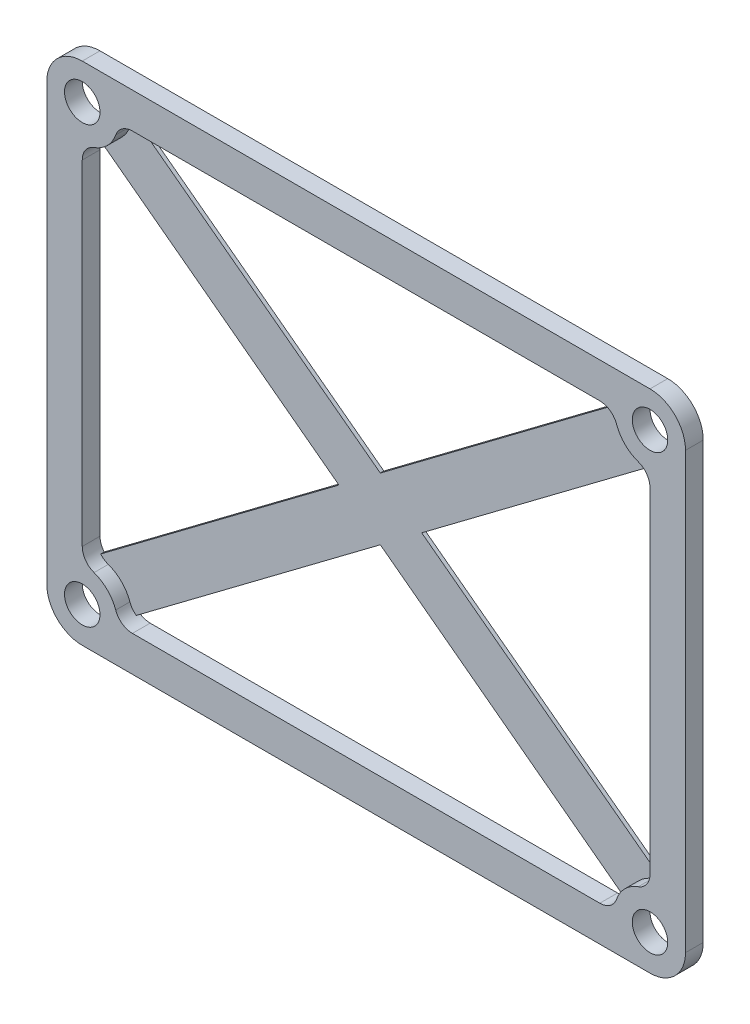
from build123d import *

# Parameters (mm, degrees)
SKETCH1_R           = 6.35
OUTLINE_DEPTH       = 6.35
FILLET2_R           = 12.7
BOSS_EXTRUDE1_DEPTH = 1.27
FILLET1_R           = 6.35


with BuildPart() as part:
    # Sketch1 → Outline (new body)
    with BuildSketch(Plane.XY):
        with BuildLine():
            Line((-101.6, 114.3), (101.6, 114.3))
            ThreePointArc((101.6, 114.3), (110.580256121, 110.580256121), (114.3, 101.6))
            Line((114.3, 101.6), (114.3, -66.802))
            Line((114.3, -66.802), (-114.3, -66.802))
            Line((-114.3, -66.802), (-114.3, 101.6))
            ThreePointArc((-114.3, 101.6), (-110.580256121, 110.580256121), (-101.6, 114.3))
        make_face()
        with Locations((-101.6, 101.6)):
            Circle(SKETCH1_R, mode=Mode.SUBTRACT)
        with Locations((101.6, 101.6)):
            Circle(SKETCH1_R, mode=Mode.SUBTRACT)
        with Locations((-101.6, -54.102)):
            Circle(SKETCH1_R, mode=Mode.SUBTRACT)
        with Locations(Location((101.6, -54.102, 0), (0, 0, 180))):
            Circle(SKETCH1_R, mode=Mode.SUBTRACT)
        with BuildLine():
            Line((-101.6, 88.9), (-101.6, -41.402))
            ThreePointArc((-101.6, -41.402), (-92.619743879, -45.121743879), (-88.9, -54.102))
            Line((-88.9, -54.102), (88.9, -54.102))
            ThreePointArc((88.9, -54.102), (92.619743879, -45.121743879), (101.6, -41.402))
            Line((101.6, -41.402), (101.6, 88.9))
            ThreePointArc((101.6, 88.9), (92.619743879, 92.619743879), (88.9, 101.6))
            Line((88.9, 101.6), (-88.9, 101.6))
            ThreePointArc((-88.9, 101.6), (-92.619743879, 92.619743879), (-101.6, 88.9))
        make_face(mode=Mode.SUBTRACT)
    extrude(amount=OUTLINE_DEPTH)

    # Fillet2
    fillet2_edges = [part.edges().sort_by_distance(p)[0] for p in [
        (114.3, -66.802, 3.175),
        (-114.3, -66.802, 3.175),
    ]]
    fillet(fillet2_edges, radius=FILLET2_R)

    # Sketch2 → Boss-Extrude1 (add)
    with BuildSketch(Plane(origin=(0, 0, 0), x_dir=(-1, 0, 0), z_dir=(0, 0, -1))):
        with BuildLine():
            Line((-101.6, 88.9), (-14.809147425, 23.749))
            Line((-14.809147425, 23.749), (-101.6, -41.402))
            ThreePointArc((-101.6, -41.402), (-92.619743879, -45.121743879), (-88.9, -54.102))
            Line((-88.9, -54.102), (0, 12.632266667))
            Line((0, 12.632266667), (88.9, -54.102))
            ThreePointArc((88.9, -54.102), (92.619743879, -45.121743879), (101.6, -41.402))
            Line((101.6, -41.402), (14.809147425, 23.749))
            Line((14.809147425, 23.749), (101.6, 88.9))
            ThreePointArc((101.6, 88.9), (92.619743879, 92.619743879), (88.9, 101.6))
            Line((88.9, 101.6), (0, 34.865733333))
            Line((0, 34.865733333), (-88.9, 101.6))
            ThreePointArc((-88.9, 101.6), (-92.619743879, 92.619743879), (-101.6, 88.9))
        make_face()
    extrude(amount=-BOSS_EXTRUDE1_DEPTH)

    # Fillet1
    # the kernel refuses this fillet: 6.35 mm, written as the material it adds along each edge
    with BuildSketch(Plane(origin=(101.6, 88.9, -11.881280605), x_dir=(0, -1, 0), z_dir=(0, 0, 1))) as fillet1_piece_1_section:
        with BuildLine():
            CenterArc((5.260512242, -6.35), FILLET1_R, 90, 70.528779366)
            ThreePointArc((-0.726325172, -4.233333333), (-0.182898292, -2.14759513), (0, 0))
            Line((0, 0), (5.260512242, 0))
        make_face()
    fillet1_piece_1 = extrude(amount=18.231280605, mode=Mode.PRIVATE)
    fillet1_piece_1 = split(fillet1_piece_1, bisect_by=Plane(origin=(101.237498755, 87.006858293, 0), z_dir=(0, 0, 1)), keep=Keep.TOP, mode=Mode.PRIVATE)
    add(fillet1_piece_1)
    with BuildSketch(Plane(origin=(88.9, 101.6, -11.881280605), x_dir=(-1, 0, 0), z_dir=(0, 0, 1))) as fillet1_piece_2_section:
        with BuildLine():
            CenterArc((5.260512242, 6.35), FILLET1_R, 199.471220634, 70.528779366)
            ThreePointArc((-0.726325172, 4.233333333), (-0.182898292, 2.14759513), (0, 0))
            Line((0, 0), (5.260512242, 0))
        make_face()
    fillet1_piece_2 = extrude(amount=18.231280605, mode=Mode.PRIVATE)
    fillet1_piece_2 = split(fillet1_piece_2, bisect_by=Plane(origin=(86.835808608, 101.33047194, 0), z_dir=(0, 0, 1)), keep=Keep.TOP, mode=Mode.PRIVATE)
    add(fillet1_piece_2)
    with BuildSketch(Plane(origin=(-101.6, 88.9, -11.881280605), x_dir=(0, -1, 0), z_dir=(0, 0, 1))) as fillet1_piece_3_section:
        with BuildLine():
            CenterArc((5.260512242, 6.35), FILLET1_R, 199.471220634, 70.528779366)
            ThreePointArc((-0.726325172, 4.233333333), (-0.182898292, 2.14759513), (0, 0))
            Line((0, 0), (5.260512242, 0))
        make_face()
    fillet1_piece_3 = extrude(amount=18.231280605, mode=Mode.PRIVATE)
    fillet1_piece_3 = split(fillet1_piece_3, bisect_by=Plane(origin=(-101.237498755, 87.006858293, 0), z_dir=(0, 0, 1)), keep=Keep.TOP, mode=Mode.PRIVATE)
    add(fillet1_piece_3)
    with BuildSketch(Plane(origin=(-88.9, 101.6, -11.881280605), x_dir=(1, 0, 0), z_dir=(0, 0, 1))) as fillet1_piece_4_section:
        with BuildLine():
            CenterArc((5.260512242, -6.35), FILLET1_R, 90, 70.528779366)
            ThreePointArc((-0.726325172, -4.233333333), (-0.182898292, -2.14759513), (0, 0))
            Line((0, 0), (5.260512242, 0))
        make_face()
    fillet1_piece_4 = extrude(amount=18.231280605, mode=Mode.PRIVATE)
    fillet1_piece_4 = split(fillet1_piece_4, bisect_by=Plane(origin=(-86.835808608, 101.33047194, 0), z_dir=(0, 0, 1)), keep=Keep.TOP, mode=Mode.PRIVATE)
    add(fillet1_piece_4)
    with BuildSketch(Plane(origin=(-101.6, -41.402, -11.881280605), x_dir=(0, 1, 0), z_dir=(0, 0, 1))) as fillet1_piece_5_section:
        with BuildLine():
            CenterArc((5.260512242, -6.35), FILLET1_R, 90, 70.528779366)
            ThreePointArc((-0.726325172, -4.233333333), (-0.182898292, -2.14759513), (0, 0))
            Line((0, 0), (5.260512242, 0))
        make_face()
    fillet1_piece_5 = extrude(amount=18.231280605, mode=Mode.PRIVATE)
    fillet1_piece_5 = split(fillet1_piece_5, bisect_by=Plane(origin=(-101.237498755, -39.508858293, 0), z_dir=(0, 0, 1)), keep=Keep.TOP, mode=Mode.PRIVATE)
    add(fillet1_piece_5)
    with BuildSketch(Plane(origin=(101.6, -41.402, -11.881280605), x_dir=(0, 1, 0), z_dir=(0, 0, 1))) as fillet1_piece_6_section:
        with BuildLine():
            CenterArc((5.260512242, 6.35), FILLET1_R, 199.471220634, 70.528779366)
            ThreePointArc((-0.726325172, 4.233333333), (-0.182898292, 2.14759513), (0, 0))
            Line((0, 0), (5.260512242, 0))
        make_face()
    fillet1_piece_6 = extrude(amount=18.231280605, mode=Mode.PRIVATE)
    fillet1_piece_6 = split(fillet1_piece_6, bisect_by=Plane(origin=(101.237498755, -39.508858293, 0), z_dir=(0, 0, 1)), keep=Keep.TOP, mode=Mode.PRIVATE)
    add(fillet1_piece_6)
    with BuildSketch(Plane(origin=(-88.9, -54.102, -11.881280605), x_dir=(1, 0, 0), z_dir=(0, 0, 1))) as fillet1_piece_7_section:
        with BuildLine():
            CenterArc((5.260512242, 6.35), FILLET1_R, 199.471220634, 70.528779366)
            ThreePointArc((-0.726325172, 4.233333333), (-0.182898292, 2.14759513), (0, 0))
            Line((0, 0), (5.260512242, 0))
        make_face()
    fillet1_piece_7 = extrude(amount=18.231280605, mode=Mode.PRIVATE)
    fillet1_piece_7 = split(fillet1_piece_7, bisect_by=Plane(origin=(-86.835808608, -53.83247194, 0), z_dir=(0, 0, 1)), keep=Keep.TOP, mode=Mode.PRIVATE)
    add(fillet1_piece_7)
    with BuildSketch(Plane(origin=(88.9, -54.102, -11.881280605), x_dir=(-1, 0, 0), z_dir=(0, 0, 1))) as fillet1_piece_8_section:
        with BuildLine():
            CenterArc((5.260512242, -6.35), FILLET1_R, 90, 70.528779366)
            ThreePointArc((-0.726325172, -4.233333333), (-0.182898292, -2.14759513), (0, 0))
            Line((0, 0), (5.260512242, 0))
        make_face()
    fillet1_piece_8 = extrude(amount=18.231280605, mode=Mode.PRIVATE)
    fillet1_piece_8 = split(fillet1_piece_8, bisect_by=Plane(origin=(86.835808608, -53.83247194, 0), z_dir=(0, 0, 1)), keep=Keep.TOP, mode=Mode.PRIVATE)
    add(fillet1_piece_8)


solid = part.part
